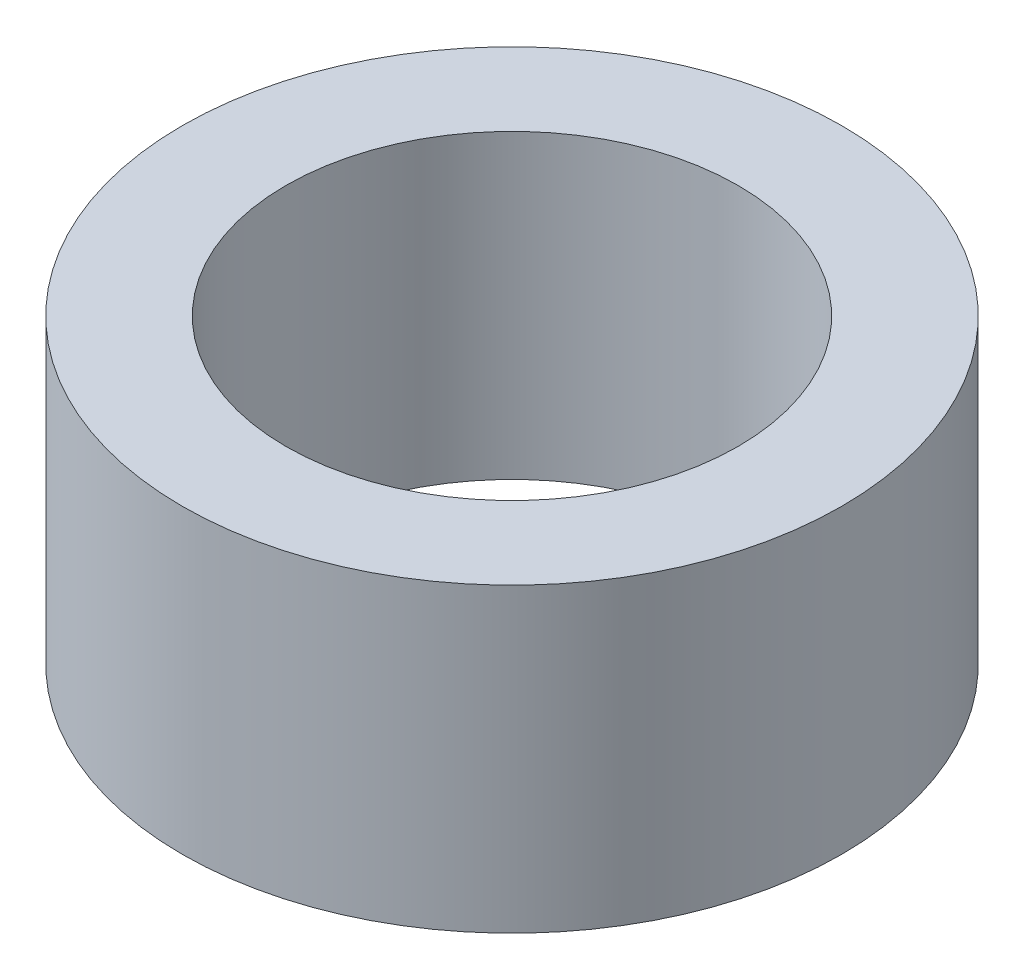
from build123d import *

# Parameters (mm, degrees)
SKETCH1_R           = 11.1125
BOSS_EXTRUDE1_DEPTH = 10.16
SKETCH4_R           = 7.62
CUT_EXTRUDE1_DEPTH  = 19.713655776


with BuildPart() as part:
    # Sketch1 → Boss-Extrude1 (new body)
    with BuildSketch(Plane(origin=(0, 0, 0), x_dir=(1, 0, 0), z_dir=(0, 1, 0))):
        Circle(SKETCH1_R)
    extrude(amount=BOSS_EXTRUDE1_DEPTH)

    # Sketch4 → Cut-Extrude1 (cut, through all)
    with BuildSketch(Plane(origin=(0, 10.16, 0), x_dir=(1, 0, 0), z_dir=(0, 1, 0))):
        Circle(SKETCH4_R)
    extrude(amount=-CUT_EXTRUDE1_DEPTH, mode=Mode.SUBTRACT)


solid = part.part
